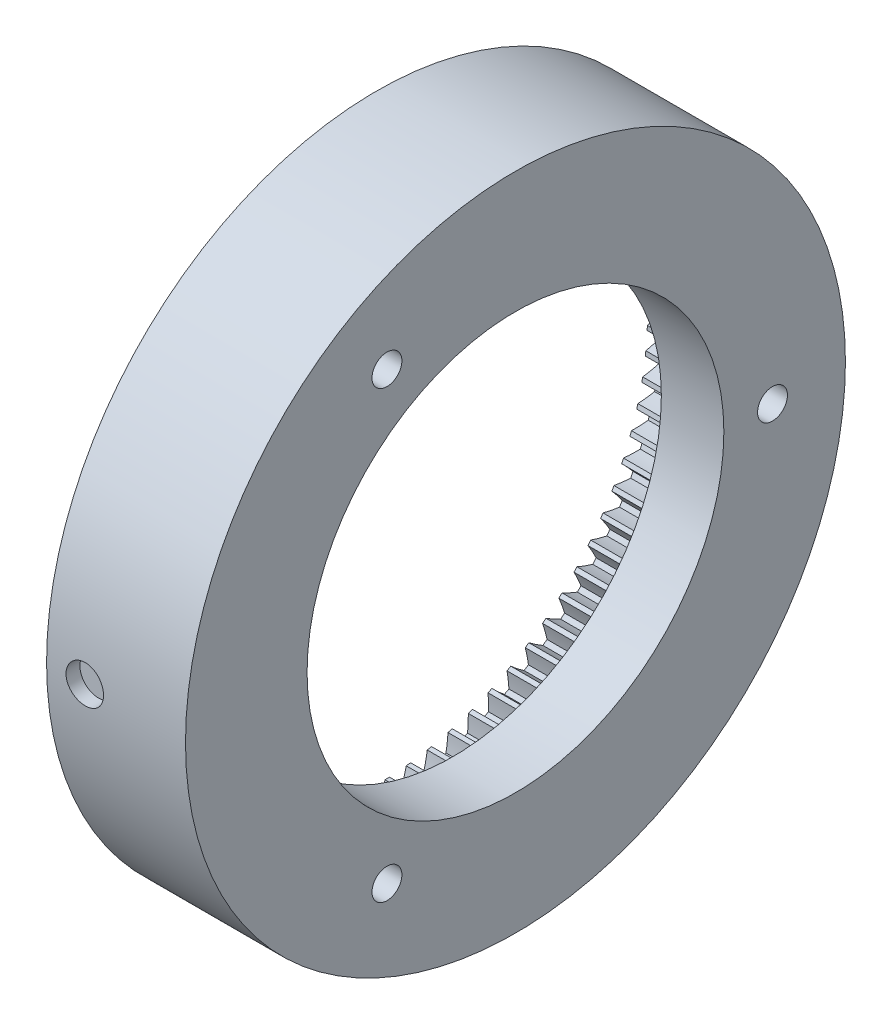
from build123d import *

# Parameters (mm, degrees)
BASPROSKE_W         = 10
BASPROSKE_H         = 8.5
TOOTHCUT_DEPTH      = 68.915388536
TEETHCUTS_COUNT     = 80
TEETHCUTS_ANGLE     = 355.5
SKETCH1_R           = 47.5
BOSS_EXTRUDE1_DEPTH = 1
BOSS_EXTRUDE3_START = 9
SKETCH3_R           = 47.5
BOSS_EXTRUDE3_DEPTH = 9
SKETCH4_R           = 2.15
CUT_EXTRUDE1_DEPTH  = 7
SKETCH4_3_R         = 30
CUT_EXTRUDE2_DEPTH  = 71.089228844
SKETCH7_R           = 2.7
CUT_EXTRUDE4_DEPTH  = 2


with BuildPart() as part:
    # BasProSke → Base-Revolve (revolve)
    with BuildSketch(Plane(origin=(0, 0, 0), x_dir=(1, 0, 0), z_dir=(0, 1, 0))):
        with Locations((5, 43.25)):
            Rectangle(BASPROSKE_W, BASPROSKE_H)
    revolve(axis=Axis((-10, 0, 0), (1, 0, 0)))

    # TooCutSke → ToothCut (cut, through all)
    with BuildSketch(Plane(origin=(0, 0, 0), x_dir=(0, 0, -1), z_dir=(1, 0, 0))):
        with BuildLine():
            ThreePointArc((1.225305221, 38.955334324), (0.834368139, 40.115367933), (0.373194628, 41.249311834))
            ThreePointArc((0.373194628, 41.249311834), (0, 41.251), (-0.373194628, 41.249311834))
            ThreePointArc((-0.373194628, 41.249311834), (-0.834368139, 40.115367933), (-1.225305221, 38.955334324))
            ThreePointArc((-1.225305221, 38.955334324), (0, 38.9746), (1.225305221, 38.955334324))
        make_face()
    toothcut = extrude(amount=TOOTHCUT_DEPTH, mode=Mode.SUBTRACT)

    # TeethCuts: ToothCut ×80 about axis
    teethcuts_axis = Axis((-10, 0, 0), (1, 0, 0))
    for i in range(1, TEETHCUTS_COUNT):
        add(toothcut.rotate(teethcuts_axis, i * TEETHCUTS_ANGLE / (TEETHCUTS_COUNT - 1)), mode=Mode.SUBTRACT)

    # Sketch1 → Boss-Extrude1 (add)
    with BuildSketch(Plane(origin=(10, 0, 0), x_dir=(0, 0, -1), z_dir=(1, 0, 0))):
        Circle(SKETCH1_R)
        with BuildLine():
            ThreePointArc((2.864339513, 41.151434485), (2.321264091, 40.069331457), (1.844660728, 38.956350276))
            ThreePointArc((1.844660728, 38.956350276), (1.531132815, 38.969932413), (1.217505761, 38.980991261))
            ThreePointArc((1.217505761, 38.980991261), (0.829695104, 40.127935362), (0.373194628, 41.249311834))
            ThreePointArc((0.373194628, 41.249311834), (0, 41.251), (-0.373194628, 41.249311834))
            ThreePointArc((-0.373194628, 41.249311834), (-0.829695104, 40.127935362), (-1.217505761, 38.980991261))
            ThreePointArc((-1.217505761, 38.980991261), (-1.531132815, 38.969932413), (-1.844660728, 38.956350276))
            ThreePointArc((-1.844660728, 38.956350276), (-2.321264091, 40.069331457), (-2.864339513, 41.151434485))
            ThreePointArc((-2.864339513, 41.151434485), (-3.236516158, 41.123836934), (-3.608427899, 41.092873459))
            ThreePointArc((-3.608427899, 41.092873459), (-3.975538953, 39.939137202), (-4.272165922, 38.765301474))
            ThreePointArc((-4.272165922, 38.765301474), (-4.583958501, 38.729669821), (-4.89545427, 38.691530436))
            ThreePointArc((-4.89545427, 38.691530436), (-5.457911921, 39.763686799), (-6.084214047, 40.799844858))
            ThreePointArc((-6.084214047, 40.799844858), (-6.453078117, 40.743131738), (-6.821414013, 40.683083854))
            ThreePointArc((-6.821414013, 40.683083854), (-7.096872282, 39.50410098), (-7.300486759, 38.310610711))
            ThreePointArc((-7.300486759, 38.310610711), (-7.608522559, 38.250625936), (-7.916065709, 38.188164445))
            ThreePointArc((-7.916065709, 38.188164445), (-8.560909909, 39.212885789), (-9.266577379, 40.19671062))
            ThreePointArc((-9.266577379, 40.19671062), (-9.629854704, 40.111231586), (-9.99234384, 40.022469509))
            ThreePointArc((-9.99234384, 40.022469509), (-10.174451033, 38.825508838), (-10.283797668, 37.619722295))
            ThreePointArc((-10.283797668, 37.619722295), (-10.586177545, 37.535754222), (-10.88787197, 37.449355722))
            ThreePointArc((-10.88787197, 37.449355722), (-11.611127041, 38.420324299), (-12.39180918, 39.345750294))
            ThreePointArc((-12.39180918, 39.345750294), (-12.747260035, 39.232032354), (-13.101667545, 39.11510333))
            ThreePointArc((-13.101667545, 39.11510333), (-13.189300911, 37.907544524), (-13.203705545, 36.69689578))
            ThreePointArc((-13.203705545, 36.69689578), (-13.498565226, 36.589462101), (-13.79255088, 36.479659267))
            ThreePointArc((-13.79255088, 36.479659267), (-14.589757713, 37.390888733), (-15.440641357, 38.252210335))
            ThreePointArc((-15.440641357, 38.252210335), (-15.786074268, 38.110954596), (-16.130215113, 37.966579532))
            ThreePointArc((-16.130215113, 37.966579532), (-16.122834363, 36.755867593), (-16.042208186, 35.5478207))
            ThreePointArc((-16.042208186, 35.5478207), (-16.327729764, 35.417583779), (-16.612194127, 35.285053582))
            ThreePointArc((-16.612194127, 35.285053582), (-17.478437678, 36.130925905), (-18.394276845, 36.922832778))
            ThreePointArc((-18.394276845, 36.922832778), (-18.727562105, 36.754910129), (-19.059314541, 36.583979147))
            ThreePointArc((-19.059314541, 36.583979147), (-18.956965179, 35.377578515), (-18.781805279, 34.179581484))
            ThreePointArc((-18.781805279, 34.179581484), (-19.056228418, 34.027344276), (-19.329417673, 33.872903808))
            ThreePointArc((-19.329417673, 33.872903808), (-20.259357262, 34.648203903), (-21.2345055, 35.365813679))
            ThreePointArc((-21.2345055, 35.365813679), (-21.553588293, 35.17225942), (-21.870906957, 34.975826364))
            ThreePointArc((-21.870906957, 34.975826364), (-21.674220001, 33.781174901), (-21.405606297, 32.600613783))
            ThreePointArc((-21.405606297, 32.600613783), (-21.667239088, 32.42731488), (-21.927468932, 32.251916319))
            ThreePointArc((-21.927468932, 32.251916319), (-22.915371172, 32.951864203), (-23.943816367, 33.590752578))
            ThreePointArc((-23.943816367, 33.590752578), (-24.246729442, 33.372760035), (-24.547657959, 33.152035981))
            ThreePointArc((-24.547657959, 33.152035981), (-24.25784605, 31.976499111), (-23.897434635, 30.820652457))
            ThreePointArc((-23.897434635, 30.820652457), (-24.144664023, 30.627360304), (-24.390330053, 30.43208504))
            ThreePointArc((-24.390330053, 30.43208504), (-25.430104198, 31.052365302), (-26.505505644, 31.608593318))
            ThreePointArc((-26.505505644, 31.608593318), (-26.790381442, 31.367506487), (-27.073064487, 31.123852273))
            ThreePointArc((-27.073064487, 31.123852273), (-26.691914411, 29.974677571), (-26.241927341, 28.85067156))
            ThreePointArc((-26.241927341, 28.85067156), (-26.473229076, 28.638577868), (-26.702816679, 28.424629838))
            ThreePointArc((-26.702816679, 28.424629838), (-27.788052175, 28.961418244), (-28.903779665, 29.431556569))
            ThreePointArc((-28.903779665, 29.431556569), (-29.168861831, 29.168861831), (-29.431556569, 28.903779665))
            ThreePointArc((-29.431556569, 28.903779665), (-28.961418244, 27.788052175), (-28.424629838, 26.702816679))
            ThreePointArc((-28.424629838, 26.702816679), (-28.638577868, 26.473229076), (-28.85067156, 26.241927341))
            ThreePointArc((-28.85067156, 26.241927341), (-29.974677571, 26.691914411), (-31.123852273, 27.073064487))
            ThreePointArc((-31.123852273, 27.073064487), (-31.367506487, 26.790381442), (-31.608593318, 26.505505644))
            ThreePointArc((-31.608593318, 26.505505644), (-31.052365302, 25.430104198), (-30.43208504, 24.390330053))
            ThreePointArc((-30.43208504, 24.390330053), (-30.627360304, 24.144664023), (-30.820652457, 23.897434635))
            ThreePointArc((-30.820652457, 23.897434635), (-31.976499111, 24.25784605), (-33.152035981, 24.547657959))
            ThreePointArc((-33.152035981, 24.547657959), (-33.372760035, 24.246729442), (-33.590752578, 23.943816367))
            ThreePointArc((-33.590752578, 23.943816367), (-32.951864203, 22.915371172), (-32.251916319, 21.927468932))
            ThreePointArc((-32.251916319, 21.927468932), (-32.42731488, 21.667239088), (-32.600613783, 21.405606297))
            ThreePointArc((-32.600613783, 21.405606297), (-33.781174901, 21.674220001), (-34.975826364, 21.870906957))
            ThreePointArc((-34.975826364, 21.870906957), (-35.17225942, 21.553588293), (-35.365813679, 21.2345055))
            ThreePointArc((-35.365813679, 21.2345055), (-34.648203903, 20.259357262), (-33.872903808, 19.329417673))
            ThreePointArc((-33.872903808, 19.329417673), (-34.027344276, 19.056228418), (-34.179581484, 18.781805279))
            ThreePointArc((-34.179581484, 18.781805279), (-35.377578515, 18.956965179), (-36.583979147, 19.059314541))
            ThreePointArc((-36.583979147, 19.059314541), (-36.754910129, 18.727562105), (-36.922832778, 18.394276845))
            ThreePointArc((-36.922832778, 18.394276845), (-36.130925905, 17.478437678), (-35.285053582, 16.612194127))
            ThreePointArc((-35.285053582, 16.612194127), (-35.417583779, 16.327729764), (-35.5478207, 16.042208186))
            ThreePointArc((-35.5478207, 16.042208186), (-36.755867593, 16.122834363), (-37.966579532, 16.130215113))
            ThreePointArc((-37.966579532, 16.130215113), (-38.110954596, 15.786074268), (-38.252210335, 15.440641357))
            ThreePointArc((-38.252210335, 15.440641357), (-37.390888733, 14.589757713), (-36.479659267, 13.79255088))
            ThreePointArc((-36.479659267, 13.79255088), (-36.589462101, 13.498565226), (-36.69689578, 13.203705545))
            ThreePointArc((-36.69689578, 13.203705545), (-37.907544524, 13.189300911), (-39.11510333, 13.101667545))
            ThreePointArc((-39.11510333, 13.101667545), (-39.232032354, 12.747260035), (-39.345750294, 12.39180918))
            ThreePointArc((-39.345750294, 12.39180918), (-38.420324299, 11.611127041), (-37.449355722, 10.88787197))
            ThreePointArc((-37.449355722, 10.88787197), (-37.535754222, 10.586177545), (-37.619722295, 10.283797668))
            ThreePointArc((-37.619722295, 10.283797668), (-38.825508838, 10.174451033), (-40.022469509, 9.99234384))
            ThreePointArc((-40.022469509, 9.99234384), (-40.111231586, 9.629854704), (-40.19671062, 9.266577379))
            ThreePointArc((-40.19671062, 9.266577379), (-39.212885789, 8.560909909), (-38.188164445, 7.916065709))
            ThreePointArc((-38.188164445, 7.916065709), (-38.250625936, 7.608522559), (-38.310610711, 7.300486759))
            ThreePointArc((-38.310610711, 7.300486759), (-39.50410098, 7.096872282), (-40.683083854, 6.821414013))
            ThreePointArc((-40.683083854, 6.821414013), (-40.743131738, 6.453078117), (-40.799844858, 6.084214047))
            ThreePointArc((-40.799844858, 6.084214047), (-39.763686799, 5.457911921), (-38.691530436, 4.89545427))
            ThreePointArc((-38.691530436, 4.89545427), (-38.729669821, 4.583958501), (-38.765301474, 4.272165922))
            ThreePointArc((-38.765301474, 4.272165922), (-39.939137202, 3.975538953), (-41.092873459, 3.608427899))
            ThreePointArc((-41.092873459, 3.608427899), (-41.123836934, 3.236516158), (-41.151434485, 2.864339513))
            ThreePointArc((-41.151434485, 2.864339513), (-40.069331457, 2.321264091), (-38.956350276, 1.844660728))
            ThreePointArc((-38.956350276, 1.844660728), (-38.969932413, 1.531132815), (-38.980991261, 1.217505761))
            ThreePointArc((-38.980991261, 1.217505761), (-40.127935362, 0.829695104), (-41.249311834, 0.373194628))
            ThreePointArc((-41.249311834, 0.373194628), (-41.251, 0), (-41.249311834, -0.373194628))
            ThreePointArc((-41.249311834, -0.373194628), (-40.127935362, -0.829695104), (-38.980991261, -1.217505761))
            ThreePointArc((-38.980991261, -1.217505761), (-38.969932413, -1.531132815), (-38.956350276, -1.844660728))
            ThreePointArc((-38.956350276, -1.844660728), (-40.069331457, -2.321264091), (-41.151434485, -2.864339513))
            ThreePointArc((-41.151434485, -2.864339513), (-41.123836934, -3.236516158), (-41.092873459, -3.608427899))
            ThreePointArc((-41.092873459, -3.608427899), (-39.939137202, -3.975538953), (-38.765301474, -4.272165922))
            ThreePointArc((-38.765301474, -4.272165922), (-38.729669821, -4.583958501), (-38.691530436, -4.89545427))
            ThreePointArc((-38.691530436, -4.89545427), (-39.763686799, -5.457911921), (-40.799844858, -6.084214047))
            ThreePointArc((-40.799844858, -6.084214047), (-40.743131738, -6.453078117), (-40.683083854, -6.821414013))
            ThreePointArc((-40.683083854, -6.821414013), (-39.50410098, -7.096872282), (-38.310610711, -7.300486759))
            ThreePointArc((-38.310610711, -7.300486759), (-38.250625936, -7.608522559), (-38.188164445, -7.916065709))
            ThreePointArc((-38.188164445, -7.916065709), (-39.212885789, -8.560909909), (-40.19671062, -9.266577379))
            ThreePointArc((-40.19671062, -9.266577379), (-40.111231586, -9.629854704), (-40.022469509, -9.99234384))
            ThreePointArc((-40.022469509, -9.99234384), (-38.825508838, -10.174451033), (-37.619722295, -10.283797668))
            ThreePointArc((-37.619722295, -10.283797668), (-37.535754222, -10.586177545), (-37.449355722, -10.88787197))
            ThreePointArc((-37.449355722, -10.88787197), (-38.420324299, -11.611127041), (-39.345750294, -12.39180918))
            ThreePointArc((-39.345750294, -12.39180918), (-39.232032354, -12.747260035), (-39.11510333, -13.101667545))
            ThreePointArc((-39.11510333, -13.101667545), (-37.907544524, -13.189300911), (-36.69689578, -13.203705545))
            ThreePointArc((-36.69689578, -13.203705545), (-36.589462101, -13.498565226), (-36.479659267, -13.79255088))
            ThreePointArc((-36.479659267, -13.79255088), (-37.390888733, -14.589757713), (-38.252210335, -15.440641357))
            ThreePointArc((-38.252210335, -15.440641357), (-38.110954596, -15.786074268), (-37.966579532, -16.130215113))
            ThreePointArc((-37.966579532, -16.130215113), (-36.755867593, -16.122834363), (-35.5478207, -16.042208186))
            ThreePointArc((-35.5478207, -16.042208186), (-35.417583779, -16.327729764), (-35.285053582, -16.612194127))
            ThreePointArc((-35.285053582, -16.612194127), (-36.130925905, -17.478437678), (-36.922832778, -18.394276845))
            ThreePointArc((-36.922832778, -18.394276845), (-36.754910129, -18.727562105), (-36.583979147, -19.059314541))
            ThreePointArc((-36.583979147, -19.059314541), (-35.377578515, -18.956965179), (-34.179581484, -18.781805279))
            ThreePointArc((-34.179581484, -18.781805279), (-34.027344276, -19.056228418), (-33.872903808, -19.329417673))
            ThreePointArc((-33.872903808, -19.329417673), (-34.648203903, -20.259357262), (-35.365813679, -21.2345055))
            ThreePointArc((-35.365813679, -21.2345055), (-35.17225942, -21.553588293), (-34.975826364, -21.870906957))
            ThreePointArc((-34.975826364, -21.870906957), (-33.781174901, -21.674220001), (-32.600613783, -21.405606297))
            ThreePointArc((-32.600613783, -21.405606297), (-32.42731488, -21.667239088), (-32.251916319, -21.927468932))
            ThreePointArc((-32.251916319, -21.927468932), (-32.951864203, -22.915371172), (-33.590752578, -23.943816367))
            ThreePointArc((-33.590752578, -23.943816367), (-33.372760035, -24.246729442), (-33.152035981, -24.547657959))
            ThreePointArc((-33.152035981, -24.547657959), (-31.976499111, -24.25784605), (-30.820652457, -23.897434635))
            ThreePointArc((-30.820652457, -23.897434635), (-30.627360304, -24.144664023), (-30.43208504, -24.390330053))
            ThreePointArc((-30.43208504, -24.390330053), (-31.052365302, -25.430104198), (-31.608593318, -26.505505644))
            ThreePointArc((-31.608593318, -26.505505644), (-31.367506487, -26.790381442), (-31.123852273, -27.073064487))
            ThreePointArc((-31.123852273, -27.073064487), (-29.974677571, -26.691914411), (-28.85067156, -26.241927341))
            ThreePointArc((-28.85067156, -26.241927341), (-28.638577868, -26.473229076), (-28.424629838, -26.702816679))
            ThreePointArc((-28.424629838, -26.702816679), (-28.961418244, -27.788052175), (-29.431556569, -28.903779665))
            ThreePointArc((-29.431556569, -28.903779665), (-29.168861831, -29.168861831), (-28.903779665, -29.431556569))
            ThreePointArc((-28.903779665, -29.431556569), (-27.788052175, -28.961418244), (-26.702816679, -28.424629838))
            ThreePointArc((-26.702816679, -28.424629838), (-26.473229076, -28.638577868), (-26.241927341, -28.85067156))
            ThreePointArc((-26.241927341, -28.85067156), (-26.691914411, -29.974677571), (-27.073064487, -31.123852273))
            ThreePointArc((-27.073064487, -31.123852273), (-26.790381442, -31.367506487), (-26.505505644, -31.608593318))
            ThreePointArc((-26.505505644, -31.608593318), (-25.430104198, -31.052365302), (-24.390330053, -30.43208504))
            ThreePointArc((-24.390330053, -30.43208504), (-24.144664023, -30.627360304), (-23.897434635, -30.820652457))
            ThreePointArc((-23.897434635, -30.820652457), (-24.25784605, -31.976499111), (-24.547657959, -33.152035981))
            ThreePointArc((-24.547657959, -33.152035981), (-24.246729442, -33.372760035), (-23.943816367, -33.590752578))
            ThreePointArc((-23.943816367, -33.590752578), (-22.915371172, -32.951864203), (-21.927468932, -32.251916319))
            ThreePointArc((-21.927468932, -32.251916319), (-21.667239088, -32.42731488), (-21.405606297, -32.600613783))
            ThreePointArc((-21.405606297, -32.600613783), (-21.674220001, -33.781174901), (-21.870906957, -34.975826364))
            ThreePointArc((-21.870906957, -34.975826364), (-21.553588293, -35.17225942), (-21.2345055, -35.365813679))
            ThreePointArc((-21.2345055, -35.365813679), (-20.259357262, -34.648203903), (-19.329417673, -33.872903808))
            ThreePointArc((-19.329417673, -33.872903808), (-19.056228418, -34.027344276), (-18.781805279, -34.179581484))
            ThreePointArc((-18.781805279, -34.179581484), (-18.956965179, -35.377578515), (-19.059314541, -36.583979147))
            ThreePointArc((-19.059314541, -36.583979147), (-18.727562105, -36.754910129), (-18.394276845, -36.922832778))
            ThreePointArc((-18.394276845, -36.922832778), (-17.478437678, -36.130925905), (-16.612194127, -35.285053582))
            ThreePointArc((-16.612194127, -35.285053582), (-16.327729764, -35.417583779), (-16.042208186, -35.5478207))
            ThreePointArc((-16.042208186, -35.5478207), (-16.122834363, -36.755867593), (-16.130215113, -37.966579532))
            ThreePointArc((-16.130215113, -37.966579532), (-15.786074268, -38.110954596), (-15.440641357, -38.252210335))
            ThreePointArc((-15.440641357, -38.252210335), (-14.589757713, -37.390888733), (-13.79255088, -36.479659267))
            ThreePointArc((-13.79255088, -36.479659267), (-13.498565226, -36.589462101), (-13.203705545, -36.69689578))
            ThreePointArc((-13.203705545, -36.69689578), (-13.189300911, -37.907544524), (-13.101667545, -39.11510333))
            ThreePointArc((-13.101667545, -39.11510333), (-12.747260035, -39.232032354), (-12.39180918, -39.345750294))
            ThreePointArc((-12.39180918, -39.345750294), (-11.611127041, -38.420324299), (-10.88787197, -37.449355722))
            ThreePointArc((-10.88787197, -37.449355722), (-10.586177545, -37.535754222), (-10.283797668, -37.619722295))
            ThreePointArc((-10.283797668, -37.619722295), (-10.174451033, -38.825508838), (-9.99234384, -40.022469509))
            ThreePointArc((-9.99234384, -40.022469509), (-9.629854704, -40.111231586), (-9.266577379, -40.19671062))
            ThreePointArc((-9.266577379, -40.19671062), (-8.560909909, -39.212885789), (-7.916065709, -38.188164445))
            ThreePointArc((-7.916065709, -38.188164445), (-7.608522559, -38.250625936), (-7.300486759, -38.310610711))
            ThreePointArc((-7.300486759, -38.310610711), (-7.096872282, -39.50410098), (-6.821414013, -40.683083854))
            ThreePointArc((-6.821414013, -40.683083854), (-6.453078117, -40.743131738), (-6.084214047, -40.799844858))
            ThreePointArc((-6.084214047, -40.799844858), (-5.457911921, -39.763686799), (-4.89545427, -38.691530436))
            ThreePointArc((-4.89545427, -38.691530436), (-4.583958501, -38.729669821), (-4.272165922, -38.765301474))
            ThreePointArc((-4.272165922, -38.765301474), (-3.975538953, -39.939137202), (-3.608427899, -41.092873459))
            ThreePointArc((-3.608427899, -41.092873459), (-3.236516158, -41.123836934), (-2.864339513, -41.151434485))
            ThreePointArc((-2.864339513, -41.151434485), (-2.321264091, -40.069331457), (-1.844660728, -38.956350276))
            ThreePointArc((-1.844660728, -38.956350276), (-1.531132815, -38.969932413), (-1.217505761, -38.980991261))
            ThreePointArc((-1.217505761, -38.980991261), (-0.829695104, -40.127935362), (-0.373194628, -41.249311834))
            ThreePointArc((-0.373194628, -41.249311834), (0, -41.251), (0.373194628, -41.249311834))
            ThreePointArc((0.373194628, -41.249311834), (0.829695104, -40.127935362), (1.217505761, -38.980991261))
            ThreePointArc((1.217505761, -38.980991261), (1.531132815, -38.969932413), (1.844660728, -38.956350276))
            ThreePointArc((1.844660728, -38.956350276), (2.321264091, -40.069331457), (2.864339513, -41.151434485))
            ThreePointArc((2.864339513, -41.151434485), (3.236516158, -41.123836934), (3.608427899, -41.092873459))
            ThreePointArc((3.608427899, -41.092873459), (3.975538953, -39.939137202), (4.272165922, -38.765301474))
            ThreePointArc((4.272165922, -38.765301474), (4.583958501, -38.729669821), (4.89545427, -38.691530436))
            ThreePointArc((4.89545427, -38.691530436), (5.457911921, -39.763686799), (6.084214047, -40.799844858))
            ThreePointArc((6.084214047, -40.799844858), (6.453078117, -40.743131738), (6.821414013, -40.683083854))
            ThreePointArc((6.821414013, -40.683083854), (7.096872282, -39.50410098), (7.300486759, -38.310610711))
            ThreePointArc((7.300486759, -38.310610711), (7.608522559, -38.250625936), (7.916065709, -38.188164445))
            ThreePointArc((7.916065709, -38.188164445), (8.560909909, -39.212885789), (9.266577379, -40.19671062))
            ThreePointArc((9.266577379, -40.19671062), (9.629854704, -40.111231586), (9.99234384, -40.022469509))
            ThreePointArc((9.99234384, -40.022469509), (10.174451033, -38.825508838), (10.283797668, -37.619722295))
            ThreePointArc((10.283797668, -37.619722295), (10.586177545, -37.535754222), (10.88787197, -37.449355722))
            ThreePointArc((10.88787197, -37.449355722), (11.611127041, -38.420324299), (12.39180918, -39.345750294))
            ThreePointArc((12.39180918, -39.345750294), (12.747260035, -39.232032354), (13.101667545, -39.11510333))
            ThreePointArc((13.101667545, -39.11510333), (13.189300911, -37.907544524), (13.203705545, -36.69689578))
            ThreePointArc((13.203705545, -36.69689578), (13.498565226, -36.589462101), (13.79255088, -36.479659267))
            ThreePointArc((13.79255088, -36.479659267), (14.589757713, -37.390888733), (15.440641357, -38.252210335))
            ThreePointArc((15.440641357, -38.252210335), (15.786074268, -38.110954596), (16.130215113, -37.966579532))
            ThreePointArc((16.130215113, -37.966579532), (16.122834363, -36.755867593), (16.042208186, -35.5478207))
            ThreePointArc((16.042208186, -35.5478207), (16.327729764, -35.417583779), (16.612194127, -35.285053582))
            ThreePointArc((16.612194127, -35.285053582), (17.478437678, -36.130925905), (18.394276845, -36.922832778))
            ThreePointArc((18.394276845, -36.922832778), (18.727562105, -36.754910129), (19.059314541, -36.583979147))
            ThreePointArc((19.059314541, -36.583979147), (18.956965179, -35.377578515), (18.781805279, -34.179581484))
            ThreePointArc((18.781805279, -34.179581484), (19.056228418, -34.027344276), (19.329417673, -33.872903808))
            ThreePointArc((19.329417673, -33.872903808), (20.259357262, -34.648203903), (21.2345055, -35.365813679))
            ThreePointArc((21.2345055, -35.365813679), (21.553588293, -35.17225942), (21.870906957, -34.975826364))
            ThreePointArc((21.870906957, -34.975826364), (21.674220001, -33.781174901), (21.405606297, -32.600613783))
            ThreePointArc((21.405606297, -32.600613783), (21.667239088, -32.42731488), (21.927468932, -32.251916319))
            ThreePointArc((21.927468932, -32.251916319), (22.915371172, -32.951864203), (23.943816367, -33.590752578))
            ThreePointArc((23.943816367, -33.590752578), (24.246729442, -33.372760035), (24.547657959, -33.152035981))
            ThreePointArc((24.547657959, -33.152035981), (24.25784605, -31.976499111), (23.897434635, -30.820652457))
            ThreePointArc((23.897434635, -30.820652457), (24.144664023, -30.627360304), (24.390330053, -30.43208504))
            ThreePointArc((24.390330053, -30.43208504), (25.430104198, -31.052365302), (26.505505644, -31.608593318))
            ThreePointArc((26.505505644, -31.608593318), (26.790381442, -31.367506487), (27.073064487, -31.123852273))
            ThreePointArc((27.073064487, -31.123852273), (26.691914411, -29.974677571), (26.241927341, -28.85067156))
            ThreePointArc((26.241927341, -28.85067156), (26.473229076, -28.638577868), (26.702816679, -28.424629838))
            ThreePointArc((26.702816679, -28.424629838), (27.788052175, -28.961418244), (28.903779665, -29.431556569))
            ThreePointArc((28.903779665, -29.431556569), (29.168861831, -29.168861831), (29.431556569, -28.903779665))
            ThreePointArc((29.431556569, -28.903779665), (28.961418244, -27.788052175), (28.424629838, -26.702816679))
            ThreePointArc((28.424629838, -26.702816679), (28.638577868, -26.473229076), (28.85067156, -26.241927341))
            ThreePointArc((28.85067156, -26.241927341), (29.974677571, -26.691914411), (31.123852273, -27.073064487))
            ThreePointArc((31.123852273, -27.073064487), (31.367506487, -26.790381442), (31.608593318, -26.505505644))
            ThreePointArc((31.608593318, -26.505505644), (31.052365302, -25.430104198), (30.43208504, -24.390330053))
            ThreePointArc((30.43208504, -24.390330053), (30.627360304, -24.144664023), (30.820652457, -23.897434635))
            ThreePointArc((30.820652457, -23.897434635), (31.976499111, -24.25784605), (33.152035981, -24.547657959))
            ThreePointArc((33.152035981, -24.547657959), (33.372760035, -24.246729442), (33.590752578, -23.943816367))
            ThreePointArc((33.590752578, -23.943816367), (32.951864203, -22.915371172), (32.251916319, -21.927468932))
            ThreePointArc((32.251916319, -21.927468932), (32.42731488, -21.667239088), (32.600613783, -21.405606297))
            ThreePointArc((32.600613783, -21.405606297), (33.781174901, -21.674220001), (34.975826364, -21.870906957))
            ThreePointArc((34.975826364, -21.870906957), (35.17225942, -21.553588293), (35.365813679, -21.2345055))
            ThreePointArc((35.365813679, -21.2345055), (34.648203903, -20.259357262), (33.872903808, -19.329417673))
            ThreePointArc((33.872903808, -19.329417673), (34.027344276, -19.056228418), (34.179581484, -18.781805279))
            ThreePointArc((34.179581484, -18.781805279), (35.377578515, -18.956965179), (36.583979147, -19.059314541))
            ThreePointArc((36.583979147, -19.059314541), (36.754910129, -18.727562105), (36.922832778, -18.394276845))
            ThreePointArc((36.922832778, -18.394276845), (36.130925905, -17.478437678), (35.285053582, -16.612194127))
            ThreePointArc((35.285053582, -16.612194127), (35.417583779, -16.327729764), (35.5478207, -16.042208186))
            ThreePointArc((35.5478207, -16.042208186), (36.755867593, -16.122834363), (37.966579532, -16.130215113))
            ThreePointArc((37.966579532, -16.130215113), (38.110954596, -15.786074268), (38.252210335, -15.440641357))
            ThreePointArc((38.252210335, -15.440641357), (37.390888733, -14.589757713), (36.479659267, -13.79255088))
            ThreePointArc((36.479659267, -13.79255088), (36.589462101, -13.498565226), (36.69689578, -13.203705545))
            ThreePointArc((36.69689578, -13.203705545), (37.907544524, -13.189300911), (39.11510333, -13.101667545))
            ThreePointArc((39.11510333, -13.101667545), (39.232032354, -12.747260035), (39.345750294, -12.39180918))
            ThreePointArc((39.345750294, -12.39180918), (38.420324299, -11.611127041), (37.449355722, -10.88787197))
            ThreePointArc((37.449355722, -10.88787197), (37.535754222, -10.586177545), (37.619722295, -10.283797668))
            ThreePointArc((37.619722295, -10.283797668), (38.825508838, -10.174451033), (40.022469509, -9.99234384))
            ThreePointArc((40.022469509, -9.99234384), (40.111231586, -9.629854704), (40.19671062, -9.266577379))
            ThreePointArc((40.19671062, -9.266577379), (39.212885789, -8.560909909), (38.188164445, -7.916065709))
            ThreePointArc((38.188164445, -7.916065709), (38.250625936, -7.608522559), (38.310610711, -7.300486759))
            ThreePointArc((38.310610711, -7.300486759), (39.50410098, -7.096872282), (40.683083854, -6.821414013))
            ThreePointArc((40.683083854, -6.821414013), (40.743131738, -6.453078117), (40.799844858, -6.084214047))
            ThreePointArc((40.799844858, -6.084214047), (39.763686799, -5.457911921), (38.691530436, -4.89545427))
            ThreePointArc((38.691530436, -4.89545427), (38.729669821, -4.583958501), (38.765301474, -4.272165922))
            ThreePointArc((38.765301474, -4.272165922), (39.939137202, -3.975538953), (41.092873459, -3.608427899))
            ThreePointArc((41.092873459, -3.608427899), (41.123836934, -3.236516158), (41.151434485, -2.864339513))
            ThreePointArc((41.151434485, -2.864339513), (40.069331457, -2.321264091), (38.956350276, -1.844660728))
            ThreePointArc((38.956350276, -1.844660728), (38.969932413, -1.531132815), (38.980991261, -1.217505761))
            ThreePointArc((38.980991261, -1.217505761), (40.127935362, -0.829695104), (41.249311834, -0.373194628))
            ThreePointArc((41.249311834, -0.373194628), (41.251, 0), (41.249311834, 0.373194628))
            ThreePointArc((41.249311834, 0.373194628), (40.127935362, 0.829695104), (38.980991261, 1.217505761))
            ThreePointArc((38.980991261, 1.217505761), (38.969932413, 1.531132815), (38.956350276, 1.844660728))
            ThreePointArc((38.956350276, 1.844660728), (40.069331457, 2.321264091), (41.151434485, 2.864339513))
            ThreePointArc((41.151434485, 2.864339513), (41.123836934, 3.236516158), (41.092873459, 3.608427899))
            ThreePointArc((41.092873459, 3.608427899), (39.939137202, 3.975538953), (38.765301474, 4.272165922))
            ThreePointArc((38.765301474, 4.272165922), (38.729669821, 4.583958501), (38.691530436, 4.89545427))
            ThreePointArc((38.691530436, 4.89545427), (39.763686799, 5.457911921), (40.799844858, 6.084214047))
            ThreePointArc((40.799844858, 6.084214047), (40.743131738, 6.453078117), (40.683083854, 6.821414013))
            ThreePointArc((40.683083854, 6.821414013), (39.50410098, 7.096872282), (38.310610711, 7.300486759))
            ThreePointArc((38.310610711, 7.300486759), (38.250625936, 7.608522559), (38.188164445, 7.916065709))
            ThreePointArc((38.188164445, 7.916065709), (39.212885789, 8.560909909), (40.19671062, 9.266577379))
            ThreePointArc((40.19671062, 9.266577379), (40.111231586, 9.629854704), (40.022469509, 9.99234384))
            ThreePointArc((40.022469509, 9.99234384), (38.825508838, 10.174451033), (37.619722295, 10.283797668))
            ThreePointArc((37.619722295, 10.283797668), (37.535754222, 10.586177545), (37.449355722, 10.88787197))
            ThreePointArc((37.449355722, 10.88787197), (38.420324299, 11.611127041), (39.345750294, 12.39180918))
            ThreePointArc((39.345750294, 12.39180918), (39.232032354, 12.747260035), (39.11510333, 13.101667545))
            ThreePointArc((39.11510333, 13.101667545), (37.907544524, 13.189300911), (36.69689578, 13.203705545))
            ThreePointArc((36.69689578, 13.203705545), (36.589462101, 13.498565226), (36.479659267, 13.79255088))
            ThreePointArc((36.479659267, 13.79255088), (37.390888733, 14.589757713), (38.252210335, 15.440641357))
            ThreePointArc((38.252210335, 15.440641357), (38.110954596, 15.786074268), (37.966579532, 16.130215113))
            ThreePointArc((37.966579532, 16.130215113), (36.755867593, 16.122834363), (35.5478207, 16.042208186))
            ThreePointArc((35.5478207, 16.042208186), (35.417583779, 16.327729764), (35.285053582, 16.612194127))
            ThreePointArc((35.285053582, 16.612194127), (36.130925905, 17.478437678), (36.922832778, 18.394276845))
            ThreePointArc((36.922832778, 18.394276845), (36.754910129, 18.727562105), (36.583979147, 19.059314541))
            ThreePointArc((36.583979147, 19.059314541), (35.377578515, 18.956965179), (34.179581484, 18.781805279))
            ThreePointArc((34.179581484, 18.781805279), (34.027344276, 19.056228418), (33.872903808, 19.329417673))
            ThreePointArc((33.872903808, 19.329417673), (34.648203903, 20.259357262), (35.365813679, 21.2345055))
            ThreePointArc((35.365813679, 21.2345055), (35.17225942, 21.553588293), (34.975826364, 21.870906957))
            ThreePointArc((34.975826364, 21.870906957), (33.781174901, 21.674220001), (32.600613783, 21.405606297))
            ThreePointArc((32.600613783, 21.405606297), (32.42731488, 21.667239088), (32.251916319, 21.927468932))
            ThreePointArc((32.251916319, 21.927468932), (32.951864203, 22.915371172), (33.590752578, 23.943816367))
            ThreePointArc((33.590752578, 23.943816367), (33.372760035, 24.246729442), (33.152035981, 24.547657959))
            ThreePointArc((33.152035981, 24.547657959), (31.976499111, 24.25784605), (30.820652457, 23.897434635))
            ThreePointArc((30.820652457, 23.897434635), (30.627360304, 24.144664023), (30.43208504, 24.390330053))
            ThreePointArc((30.43208504, 24.390330053), (31.052365302, 25.430104198), (31.608593318, 26.505505644))
            ThreePointArc((31.608593318, 26.505505644), (31.367506487, 26.790381442), (31.123852273, 27.073064487))
            ThreePointArc((31.123852273, 27.073064487), (29.974677571, 26.691914411), (28.85067156, 26.241927341))
            ThreePointArc((28.85067156, 26.241927341), (28.638577868, 26.473229076), (28.424629838, 26.702816679))
            ThreePointArc((28.424629838, 26.702816679), (28.961418244, 27.788052175), (29.431556569, 28.903779665))
            ThreePointArc((29.431556569, 28.903779665), (29.168861831, 29.168861831), (28.903779665, 29.431556569))
            ThreePointArc((28.903779665, 29.431556569), (27.788052175, 28.961418244), (26.702816679, 28.424629838))
            ThreePointArc((26.702816679, 28.424629838), (26.473229076, 28.638577868), (26.241927341, 28.85067156))
            ThreePointArc((26.241927341, 28.85067156), (26.691914411, 29.974677571), (27.073064487, 31.123852273))
            ThreePointArc((27.073064487, 31.123852273), (26.790381442, 31.367506487), (26.505505644, 31.608593318))
            ThreePointArc((26.505505644, 31.608593318), (25.430104198, 31.052365302), (24.390330053, 30.43208504))
            ThreePointArc((24.390330053, 30.43208504), (24.144664023, 30.627360304), (23.897434635, 30.820652457))
            ThreePointArc((23.897434635, 30.820652457), (24.25784605, 31.976499111), (24.547657959, 33.152035981))
            ThreePointArc((24.547657959, 33.152035981), (24.246729442, 33.372760035), (23.943816367, 33.590752578))
            ThreePointArc((23.943816367, 33.590752578), (22.915371172, 32.951864203), (21.927468932, 32.251916319))
            ThreePointArc((21.927468932, 32.251916319), (21.667239088, 32.42731488), (21.405606297, 32.600613783))
            ThreePointArc((21.405606297, 32.600613783), (21.674220001, 33.781174901), (21.870906957, 34.975826364))
            ThreePointArc((21.870906957, 34.975826364), (21.553588293, 35.17225942), (21.2345055, 35.365813679))
            ThreePointArc((21.2345055, 35.365813679), (20.259357262, 34.648203903), (19.329417673, 33.872903808))
            ThreePointArc((19.329417673, 33.872903808), (19.056228418, 34.027344276), (18.781805279, 34.179581484))
            ThreePointArc((18.781805279, 34.179581484), (18.956965179, 35.377578515), (19.059314541, 36.583979147))
            ThreePointArc((19.059314541, 36.583979147), (18.727562105, 36.754910129), (18.394276845, 36.922832778))
            ThreePointArc((18.394276845, 36.922832778), (17.478437678, 36.130925905), (16.612194127, 35.285053582))
            ThreePointArc((16.612194127, 35.285053582), (16.327729764, 35.417583779), (16.042208186, 35.5478207))
            ThreePointArc((16.042208186, 35.5478207), (16.122834363, 36.755867593), (16.130215113, 37.966579532))
            ThreePointArc((16.130215113, 37.966579532), (15.786074268, 38.110954596), (15.440641357, 38.252210335))
            ThreePointArc((15.440641357, 38.252210335), (14.589757713, 37.390888733), (13.79255088, 36.479659267))
            ThreePointArc((13.79255088, 36.479659267), (13.498565226, 36.589462101), (13.203705545, 36.69689578))
            ThreePointArc((13.203705545, 36.69689578), (13.189300911, 37.907544524), (13.101667545, 39.11510333))
            ThreePointArc((13.101667545, 39.11510333), (12.747260035, 39.232032354), (12.39180918, 39.345750294))
            ThreePointArc((12.39180918, 39.345750294), (11.611127041, 38.420324299), (10.88787197, 37.449355722))
            ThreePointArc((10.88787197, 37.449355722), (10.586177545, 37.535754222), (10.283797668, 37.619722295))
            ThreePointArc((10.283797668, 37.619722295), (10.174451033, 38.825508838), (9.99234384, 40.022469509))
            ThreePointArc((9.99234384, 40.022469509), (9.629854704, 40.111231586), (9.266577379, 40.19671062))
            ThreePointArc((9.266577379, 40.19671062), (8.560909909, 39.212885789), (7.916065709, 38.188164445))
            ThreePointArc((7.916065709, 38.188164445), (7.608522559, 38.250625936), (7.300486759, 38.310610711))
            ThreePointArc((7.300486759, 38.310610711), (7.096872282, 39.50410098), (6.821414013, 40.683083854))
            ThreePointArc((6.821414013, 40.683083854), (6.453078117, 40.743131738), (6.084214047, 40.799844858))
            ThreePointArc((6.084214047, 40.799844858), (5.457911921, 39.763686799), (4.89545427, 38.691530436))
            ThreePointArc((4.89545427, 38.691530436), (4.583958501, 38.729669821), (4.272165922, 38.765301474))
            ThreePointArc((4.272165922, 38.765301474), (3.975538953, 39.939137202), (3.608427899, 41.092873459))
            ThreePointArc((3.608427899, 41.092873459), (3.236516158, 41.123836934), (2.864339513, 41.151434485))
        make_face(mode=Mode.SUBTRACT)
    extrude(amount=BOSS_EXTRUDE1_DEPTH)

    # Sketch3 → Boss-Extrude3 (add)
    with BuildSketch(Plane(origin=(11, 0, 0), x_dir=(0, 0, -1), z_dir=(1, 0, 0)).offset(BOSS_EXTRUDE3_START)):
        Circle(SKETCH3_R)
    extrude(amount=-BOSS_EXTRUDE3_DEPTH)

    # Sketch4 → Cut-Extrude1 (cut)
    with BuildSketch(Plane(origin=(20, 0, 0), x_dir=(0, 0, -1), z_dir=(1, 0, 0))):
        with Locations((37, 0)):
            Circle(SKETCH4_R)
        with Locations((-18.5, -32.04293994)):
            Circle(SKETCH4_R)
        with Locations((-18.5, 32.04293994)):
            Circle(SKETCH4_R)
    extrude(amount=-CUT_EXTRUDE1_DEPTH, mode=Mode.SUBTRACT)

    # Sketch4<3> → Cut-Extrude2 (cut, through all)
    with BuildSketch(Plane(origin=(20, 0, 0), x_dir=(0, 0, -1), z_dir=(1, 0, 0))):
        Circle(SKETCH4_3_R)
    extrude(amount=-CUT_EXTRUDE2_DEPTH, mode=Mode.SUBTRACT)

    # Sketch7 → Cut-Extrude4 (cut)
    with BuildSketch(Plane.XY.offset(47.5)):
        with Locations((5.5, 0)):
            Circle(SKETCH7_R)
    extrude(amount=-CUT_EXTRUDE4_DEPTH, mode=Mode.SUBTRACT)


solid = part.part
